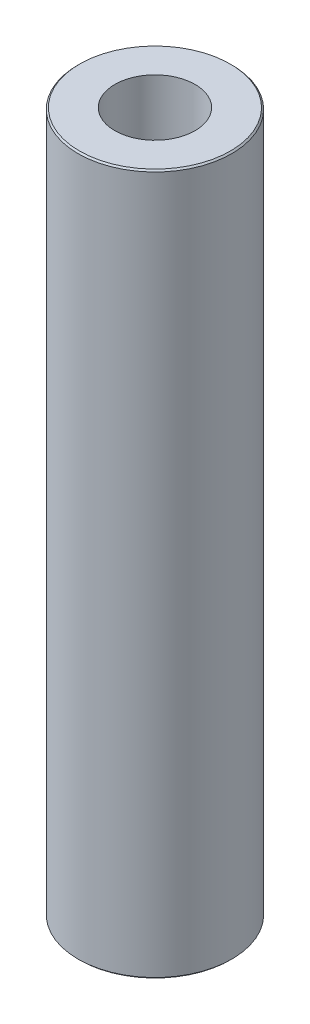
from build123d import *

# Parameters (mm, degrees)
SKETCH1_R           = 52.5
BOSS_EXTRUDE1_DEPTH = 478.452020078
SKETCH2_R           = 27.394182316
CUT_EXTRUDE1_DEPTH  = 485.178516166
CHAMFER1_SIZE       = 1.01159115


with BuildPart() as part:
    # Sketch1 → Boss-Extrude1 (new body)
    with BuildSketch(Plane(origin=(0, 0, 0), x_dir=(1, 0, 0), z_dir=(0, 1, 0))):
        Circle(SKETCH1_R)
    extrude(amount=BOSS_EXTRUDE1_DEPTH)

    # Sketch2 → Cut-Extrude1 (cut, through all)
    with BuildSketch(Plane(origin=(0, 0, 0), x_dir=(1, 0, 0), z_dir=(0, 1, 0))):
        Circle(SKETCH2_R)
    extrude(amount=CUT_EXTRUDE1_DEPTH, mode=Mode.SUBTRACT)

    # Chamfer1
    chamfer1_edges = [part.edges().sort_by_distance(p)[0] for p in [
        (-52.5, 478.452020078, 0),
        (-52.5, 0, 0),
    ]]
    chamfer(chamfer1_edges, length=CHAMFER1_SIZE)


solid = part.part
